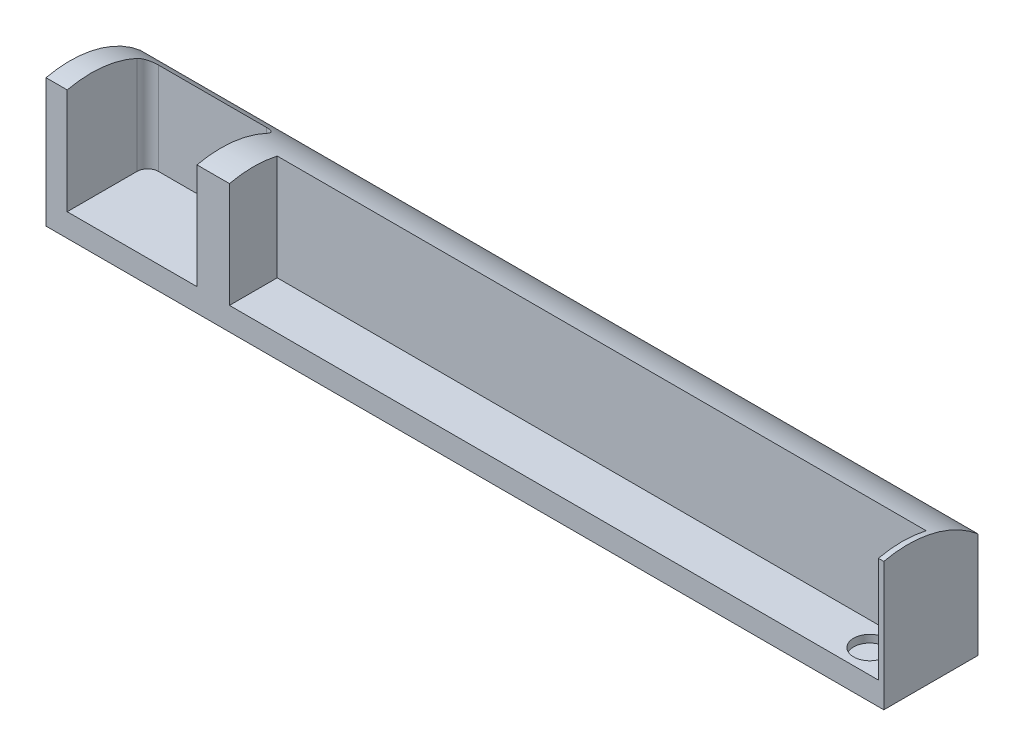
from build123d import *

# Parameters (mm, degrees)
CUT_EXTRUDE7_DEPTH               = 1010.950493836
CUT_EXTRUDE7_DEPTH_BACK          = 1010.950493836
SKETCH13_W                       = 48.176434887
SKETCH13_H                       = 155.804640487
SKETCH4_W                        = 600
SKETCH4_H                        = 44.158972604
CUT_EXTRUDE2_DEPTH               = 1010.950493836
SKETCH7_W                        = 159.807953253
SKETCH7_H                        = 69.49104999
BOSS_EXTRUDE7_DEPTH              = 5
FILLET5_R                        = 10
F_5_8_0_625_DIAMETER_HOLE1_D     = 15.875
F_5_8_0_625_DIAMETER_HOLE1_DEPTH = 30
F_5_8_0_625_DIAMETER_HOLE1_TIP   = 4.769331164
BOSS_EXTRUDE8_DEPTH              = 10
BOSS_EXTRUDE8_DEPTH_BACK         = 10
SKETCH16_W                       = 57.403477863
SKETCH16_H                       = 23.203595883
SKETCH17_W                       = 38.256761469
SKETCH17_H                       = 12.64819079
BOSS_EXTRUDE9_DEPTH              = 10
SKETCH18_W                       = 120
SKETCH18_H                       = 104.74536306
CUT_EXTRUDE8_DEPTH               = 161
FILLET6_R                        = 10
SKETCH19_R                       = 15
CUT_EXTRUDE9_DEPTH               = 7
CUT_EXTRUDE11_DEPTH              = 1010.950493856
CUT_EXTRUDE11_DEPTH_BACK         = 1010.950493856
SKETCH22_W                       = 1481.455902665
SKETCH22_H                       = 524.99926461
SKETCH22_W_2                     = 774.615564444
SKETCH22_H_2                     = 130
SKETCH23_W                       = 1033.221047575
SKETCH23_H                       = 313.410359552
SKETCH23_W_2                     = 790.959514037
SKETCH23_H_2                     = 163.499719248
CUT_EXTRUDE12_DEPTH              = 915.822387207
CUT_EXTRUDE13_DEPTH              = 908.868382599
CUT_EXTRUDE13_DEPTH_BACK         = 908.868382599
SKETCH24_W                       = 774.615564444
SKETCH24_H                       = 42.920513698


# Read off the part's stored shape, not the designer's step: Revolve1
with BuildPart() as part:
    # Revolve1 outline → Revolve1 (revolve)
    with BuildSketch(Plane.YX):
        with BuildLine():
            Line((0, 1000), (0, 0))
            ThreePointArc((0, 0), (70.710678154, 29.289321917), (100, 100.0000001))
            Line((100, 100.0000001), (100, 899.9999999))
            ThreePointArc((100, 899.9999999), (70.710678154, 970.710678083), (0, 1000))
        make_face()
    revolve(axis=Axis((0, 0, 0), (1, 0, 0)))

    # Sketch13 → Cut-Extrude7 (cut, two sides: drawn at the far end of the back side and taken through both)
    with BuildSketch(Plane(origin=(0, 0, 0), x_dir=(1, 0, 0), z_dir=(0, 1, 0)).offset(-CUT_EXTRUDE7_DEPTH_BACK)):
        with Locations((5.911782557, -3.075091589)):
            Rectangle(SKETCH13_W, SKETCH13_H)
    extrude(amount=CUT_EXTRUDE7_DEPTH + CUT_EXTRUDE7_DEPTH_BACK, mode=Mode.SUBTRACT)

    # Sketch4 → Cut-Extrude2 (cut, through all)
    with BuildSketch(Plane(origin=(0, 0, 0), x_dir=(1, 0, 0), z_dir=(0, 1, 0))):
        with Locations((595, 0)):
            Rectangle(SKETCH4_W, SKETCH4_H)
    extrude(amount=CUT_EXTRUDE2_DEPTH, mode=Mode.SUBTRACT)

    # Sketch7 → Boss-Extrude7 (add)
    with BuildSketch(Plane(origin=(0, 0, 0), x_dir=(1, 0, 0), z_dir=(0, 1, 0))):
        with Locations((745.885521462, -1.405844332)):
            Rectangle(SKETCH7_W, SKETCH7_H)
    extrude(amount=-BOSS_EXTRUDE7_DEPTH)

    # Fillet5
    fillet5_edges = [part.edges().sort_by_distance(p)[0] for p in [
        (30, -71.414284286, 0),
    ]]
    fillet(fillet5_edges, radius=FILLET5_R)

    # 5/8 (0.625) Diameter Hole1
    with Locations(Plane.ZY.offset(-30)):
        with Locations((0, 0)):
            Hole(F_5_8_0_625_DIAMETER_HOLE1_D / 2, depth=F_5_8_0_625_DIAMETER_HOLE1_DEPTH)
            with Locations((0, 0, -(F_5_8_0_625_DIAMETER_HOLE1_DEPTH + F_5_8_0_625_DIAMETER_HOLE1_TIP / 2))):  # 118° drill point
                Cone(0, F_5_8_0_625_DIAMETER_HOLE1_D / 2, F_5_8_0_625_DIAMETER_HOLE1_TIP, mode=Mode.SUBTRACT)

    # Sketch16 → Boss-Extrude8 (add, two sides: drawn at the far end of the back side and taken through both)
    with BuildSketch(Plane.XY.offset(-BOSS_EXTRUDE8_DEPTH_BACK)):
        with Locations((738.294537666, -11.601797942)):
            Rectangle(SKETCH16_W, SKETCH16_H)
    extrude(amount=BOSS_EXTRUDE8_DEPTH + BOSS_EXTRUDE8_DEPTH_BACK)

    # Sketch17 → Boss-Extrude9 (add)
    with BuildSketch(Plane.XY.offset(-22.079486302)):
        with Locations((787.071835847, 6.324095395)):
            Rectangle(SKETCH17_W, SKETCH17_H)
    extrude(amount=-BOSS_EXTRUDE9_DEPTH)

    # Sketch18 → Cut-Extrude8 (cut)
    with BuildSketch(Plane(origin=(0, 0, 0), x_dir=(1, 0, 0), z_dir=(0, 1, 0))):
        with Locations((204.992275313, 0)):
            Rectangle(SKETCH18_W, SKETCH18_H)
    extrude(amount=CUT_EXTRUDE8_DEPTH, mode=Mode.SUBTRACT)

    # Fillet6
    fillet6_edges = [part.edges().sort_by_distance(p)[0] for p in [
        (144.992275313, 42.594313674, -52.37268153),
        (144.992275313, 42.594313674, 52.37268153),
        (264.992275313, 42.594313674, 52.37268153),
        (264.992275313, 42.594313674, -52.37268153),
    ]]
    fillet(fillet6_edges, radius=FILLET6_R)

    # Sketch19 → Cut-Extrude9 (cut)
    with BuildSketch(Plane(origin=(0, 0, 0), x_dir=(1, 0, 0), z_dir=(0, 1, 0))):
        with Locations(Location((865, 0, 0), (0, 0, 270))):
            Circle(SKETCH19_R)
    extrude(amount=-CUT_EXTRUDE9_DEPTH, mode=Mode.SUBTRACT)

    # Sketch22 → Cut-Extrude11 (cut, two sides: drawn at the far end of the back side and taken through both)
    with BuildSketch(Plane(origin=(0, 0, 0), x_dir=(1, 0, 0), z_dir=(0, 1, 0)).offset(-CUT_EXTRUDE11_DEPTH_BACK)):
        with Locations((406.155110175, 0)):
            Rectangle(SKETCH22_W, SKETCH22_H)
        with Locations((512.692217778, 0)):
            Rectangle(SKETCH22_W_2, SKETCH22_H_2, mode=Mode.SUBTRACT)
    extrude(amount=CUT_EXTRUDE11_DEPTH + CUT_EXTRUDE11_DEPTH_BACK, mode=Mode.SUBTRACT)

    # Sketch23 → Cut-Extrude12 (cut, through all)
    with BuildSketch(Plane.XY.offset(65)):
        with Locations((481.89787613, -1.932796335)):
            Rectangle(SKETCH23_W, SKETCH23_H)
        with Locations((520.864192575, 60.415600646)):
            Rectangle(SKETCH23_W_2, SKETCH23_H_2, mode=Mode.SUBTRACT)
    extrude(amount=-CUT_EXTRUDE12_DEPTH, mode=Mode.SUBTRACT)

    # Sketch24 → Cut-Extrude13 (cut, two sides: drawn at the far end of the back side and taken through both)
    with BuildSketch(Plane(origin=(0, 0, 0), x_dir=(1, 0, 0), z_dir=(0, 1, 0)).offset(-CUT_EXTRUDE13_DEPTH_BACK)):
        with Locations((512.692217778, -43.539743151)):
            Rectangle(SKETCH24_W, SKETCH24_H)
    extrude(amount=CUT_EXTRUDE13_DEPTH + CUT_EXTRUDE13_DEPTH_BACK, mode=Mode.SUBTRACT)


solid = part.part
